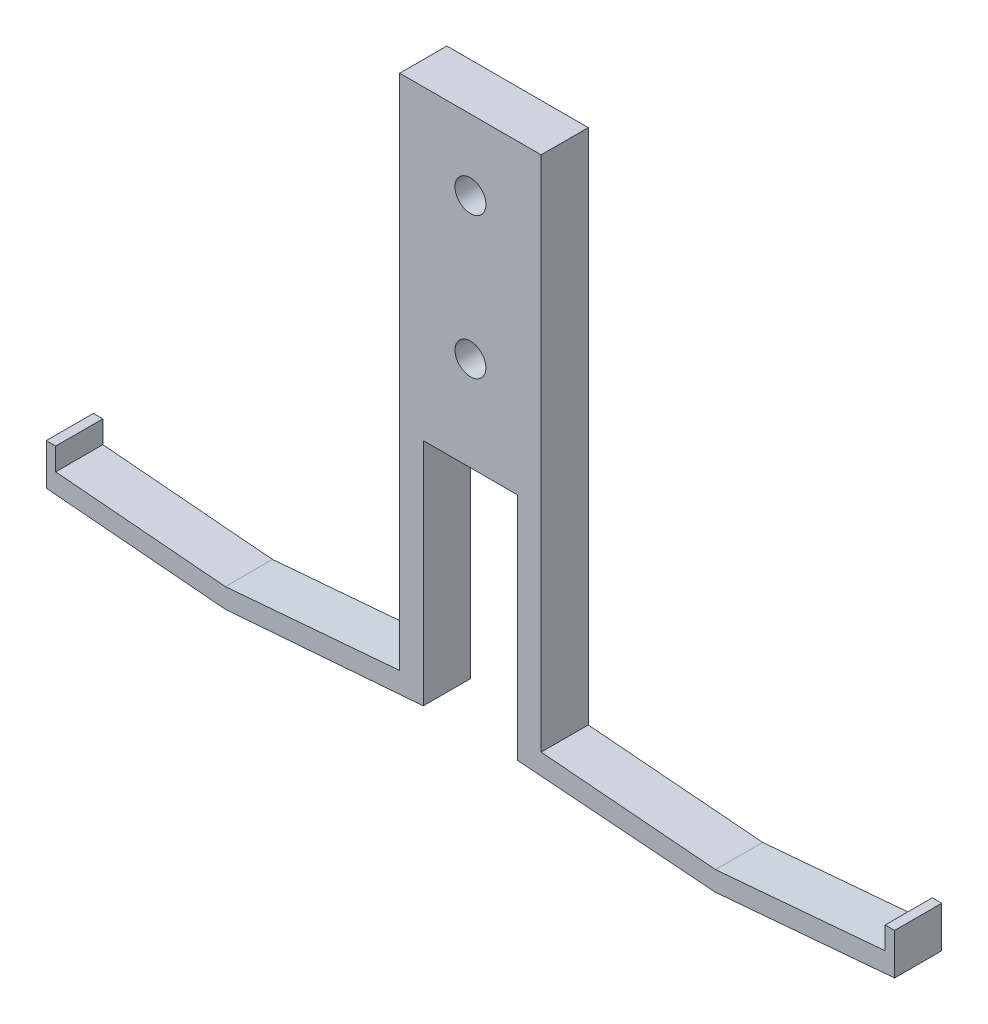
from build123d import *

# Parameters (mm, degrees)
BOSS_EXTRUDE1_DEPTH              = 12.7
F_21_64_0_32813_DIAMETER_HOLE1_D = 8.334502


with BuildPart() as part:
    # Sketch2 → Boss-Extrude1 (new body)
    with BuildSketch(Plane.XY):
        Polygon((12.7, 0), (12.7, -61.9179737), (66.04, -66.051353419), (114.3, -61.9179737), (114.3, -50.811353419), (111.76, -50.811353419), (111.76, -56.8379737), (66.04, -60.753807118), (19.05, -56.8379737), (19.05, 82.55), (-19.05, 82.55), (-19.05, -56.8379737), (-66.04, -60.753807118), (-111.76, -56.8379737), (-111.76, -50.811353419), (-114.3, -50.811353419), (-114.3, -61.9179737), (-66.04, -66.051353419), (-12.7, -61.9179737), (-12.7, 0), align=None)
    extrude(amount=BOSS_EXTRUDE1_DEPTH)

    # 21/64 (0.32813) Diameter Hole1 (through all)
    with Locations(Plane.XY.offset(12.7)):
        with Locations((0, 25.4), (0, 63.5)):
            Hole(F_21_64_0_32813_DIAMETER_HOLE1_D / 2)


solid = part.part
